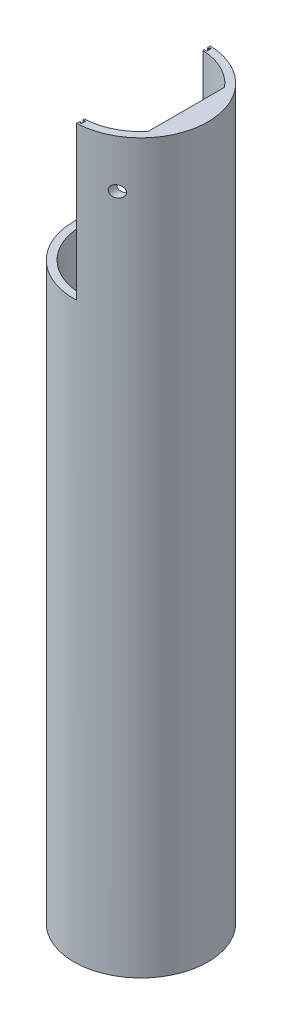
from build123d import *

# Parameters (mm, degrees)
SKETCH3_R           = 17.5
SKETCH3_R_2         = 15.5
BOSS_EXTRUDE1_DEPTH = 150
BOSS_EXTRUDE2_DEPTH = 20
BOSS_EXTRUDE3_DEPTH = 20
SKETCH6_W           = 5
SKETCH6_H           = 5
BOSS_EXTRUDE4_DEPTH = 6
SKETCH7_R           = 1.5
CUT_EXTRUDE2_DEPTH  = 50
SKETCH9_W           = 6
SKETCH9_H           = 10
CUT_EXTRUDE3_DEPTH  = 2
FILLET3_R           = 3.2


with BuildPart() as part:
    # Sketch3 → Boss-Extrude1 (new body)
    with BuildSketch(Plane(origin=(0, 0, 0), x_dir=(1, 0, 0), z_dir=(0, 1, 0))):
        with Locations(Location((0, 0, 0), (0, 0, 270))):
            Circle(SKETCH3_R)
        with Locations(Location((0, 0, 0), (0, 0, 270))):
            Circle(SKETCH3_R_2, mode=Mode.SUBTRACT)
    extrude(amount=BOSS_EXTRUDE1_DEPTH)

    # Sketch4 → Boss-Extrude2 (add)
    with BuildSketch(Plane(origin=(0, 150, 0), x_dir=(1, 0, 0), z_dir=(0, 1, 0))):
        with BuildLine():
            ThreePointArc((17.5, 0), (12.609164887, 12.135030319), (0.670404475, 17.487154081))
            Line((0.670404475, 17.487154081), (0.670404475, 16.661380915))
            Line((0.670404475, 16.661380915), (0.999793375, 16.661380915))
            Line((0.999793375, 16.661380915), (0.999793375, 16.95829018))
            Line((0.999793375, 16.95829018), (1.342992881, 16.95829018))
            Line((1.342992881, 16.95829018), (1.340586782, 15.830625123))
            Line((1.340586782, 15.830625123), (0.65523527, 15.830625123))
            Line((0.65523527, 15.830625123), (0.65523527, 15.486144347))
            ThreePointArc((0.65523527, 15.486144347), (11.189417918, 10.725993038), (15.5, 0))
            Line((15.5, 0), (17.5, 0))
        make_face()
        with BuildLine():
            ThreePointArc((0.670404475, -17.487154081), (12.609164887, -12.135030319), (17.5, 0))
            Line((17.5, 0), (15.5, 0))
            ThreePointArc((15.5, 0), (11.189417918, -10.725993038), (0.65523527, -15.486144347))
            Line((0.65523527, -15.486144347), (0.65523527, -15.830625123))
            Line((0.65523527, -15.830625123), (1.340586782, -15.830625123))
            Line((1.340586782, -15.830625123), (1.342992881, -16.95829018))
            Line((1.342992881, -16.95829018), (0.999793375, -16.95829018))
            Line((0.999793375, -16.95829018), (0.999793375, -16.661380915))
            Line((0.999793375, -16.661380915), (0.670404475, -16.661380915))
            Line((0.670404475, -16.661380915), (0.670404475, -17.487154081))
        make_face()
    extrude(amount=BOSS_EXTRUDE2_DEPTH)

    # Sketch5 → Boss-Extrude3 (add)
    with BuildSketch(Plane(origin=(0, 170, 0), x_dir=(1, 0, 0), z_dir=(0, 1, 0))):
        with BuildLine():
            Line((0.65523527, 15.830625123), (0.65523527, 15.486144347))
            ThreePointArc((0.65523527, 15.486144347), (15.5, 0), (0.65523527, -15.486144347))
            Line((0.65523527, -15.486144347), (0.65523527, -15.830625123))
            Line((0.65523527, -15.830625123), (1.340586782, -15.830625123))
            Line((1.340586782, -15.830625123), (1.342992881, -16.95829018))
            Line((1.342992881, -16.95829018), (0.999793375, -16.95829018))
            Line((0.999793375, -16.95829018), (0.999793375, -16.661380915))
            Line((0.999793375, -16.661380915), (0.670404475, -16.661380915))
            Line((0.670404475, -16.661380915), (0.670404475, -17.487154081))
            ThreePointArc((0.670404475, -17.487154081), (17.5, 0), (0.670404475, 17.487154081))
            Line((0.670404475, 17.487154081), (0.670404475, 16.661380915))
            Line((0.670404475, 16.661380915), (0.999793375, 16.661380915))
            Line((0.999793375, 16.661380915), (0.999793375, 16.95829018))
            Line((0.999793375, 16.95829018), (1.342992881, 16.95829018))
            Line((1.342992881, 16.95829018), (1.340586782, 15.830625123))
            Line((1.340586782, 15.830625123), (0.65523527, 15.830625123))
        make_face()
        with BuildLine():
            ThreePointArc((11.842719282, -10), (15.5, 0), (11.842719282, 10))
            Line((11.842719282, 10), (11.842719282, -10))
        make_face()
    extrude(amount=BOSS_EXTRUDE3_DEPTH)

    # Sketch6 → Boss-Extrude4 (add)
    with BuildSketch(Plane.ZY.offset(-11.842719282)):
        with Locations((-6.2, 177.5)):
            Rectangle(SKETCH6_W, SKETCH6_H)
        with Locations((6.2, 177.5)):
            Rectangle(SKETCH6_W, SKETCH6_H)
    extrude(amount=BOSS_EXTRUDE4_DEPTH)

    # Sketch7 → Cut-Extrude2 (cut)
    with BuildSketch(Plane(origin=(0, 0, -8.7), x_dir=(-1, 0, 0), z_dir=(0, 0, -1))):
        with Locations((-8.842719282, 177.5)):
            Circle(SKETCH7_R)
    extrude(amount=-CUT_EXTRUDE2_DEPTH, mode=Mode.SUBTRACT)

    # Sketch9 → Cut-Extrude3 (cut)
    with BuildSketch(Plane.ZY.offset(-11.842719282)):
        with Locations((0, 177.5)):
            Rectangle(SKETCH9_W, SKETCH9_H)
    extrude(amount=-CUT_EXTRUDE3_DEPTH, mode=Mode.SUBTRACT)

    # Fillet3
    # the kernel refuses this fillet: 3.2 mm, written as the material it adds along each edge
    with BuildSketch(Plane(origin=(13.842719282, 172.5, -3), x_dir=(-1, 0, 0), z_dir=(0, 1, 0)), Plane(origin=(13.842719282, 189.916198487, 3), x_dir=(-1, 0, 0), z_dir=(0, -1, 0))) as fillet3_piece_1:
        with BuildLine():
            CenterArc((3.2, 2.966479395), FILLET3_R, 180, 67.975687163)
            Line((0, 2.966479395), (-0.064, 2.966479395))
            Line((-0.064, 2.966479395), (-0.064, 0))
            Line((-0.064, 0), (0, -0.064))
            ThreePointArc((0, -0.064), (1, -0.064), (1.976, -0.059329588))
            Line((1.976, -0.059329588), (2, 0))
        make_face()
    extrude(amount=17.416198487)
    with BuildSketch(Plane(origin=(13.842719282, 172.5, 10.416198487), x_dir=(-1, 0, 0), z_dir=(0, 0, -1)), Plane(origin=(13.842719282, 182.5, -10.416198487), x_dir=(-1, 0, 0), z_dir=(0, 0, 1))) as fillet3_piece_2:
        with BuildLine():
            CenterArc((3.2, 2.966479395), FILLET3_R, 180, 67.975687163)
            Line((0, 2.966479395), (-0.064, 2.966479395))
            Line((-0.064, 2.966479395), (-0.064, 0))
            Line((-0.064, 0), (0, -0.064))
            ThreePointArc((0, -0.064), (1, -0.064), (1.976, -0.059329588))
            Line((1.976, -0.059329588), (2, 0))
        make_face()
    extrude(amount=20.832396974)


solid = part.part
